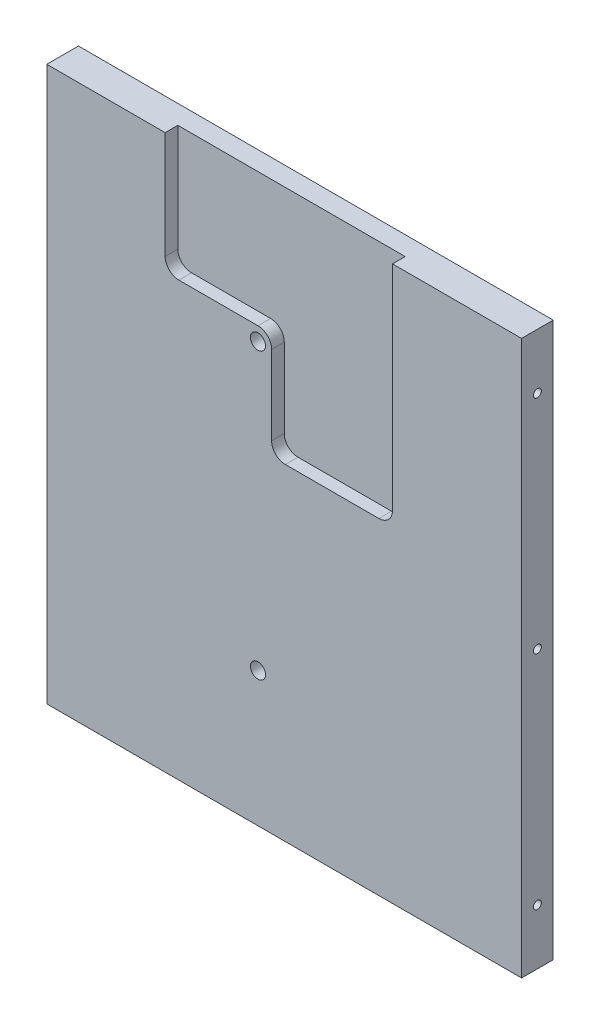
from build123d import *

# Parameters (mm, degrees)
SKIZZE1_W                       = 150
SKIZZE1_H                       = 175
AUFSATZ_LINEAR_AUSTRAGEN1_DEPTH = 10
SKIZZE2_R                       = 2.3876
SCHNITT_LINEAR_AUSTRAGEN1_DEPTH = 10
SCHNITT_LINEAR_AUSTRAGEN2_DEPTH = 4
SKIZZE4_R                       = 1.25
SCHNITT_LINEAR_AUSTRAGEN3_DEPTH = 5
SCHNITT_LINEAR_START            = -5
SKIZZE6_R                       = 1.25
SCHNITT_LINEAR_AUSTRAGEN4_DEPTH = 5


with BuildPart() as part:
    # Skizze1 → Aufsatz-Linear austragen1 (new body)
    with BuildSketch(Plane.XY):
        with Locations((-21.140947697, -18.099765847)):
            Rectangle(SKIZZE1_W, SKIZZE1_H)
    extrude(amount=AUFSATZ_LINEAR_AUSTRAGEN1_DEPTH)

    # Skizze2 → Schnitt-Linear austragen1 (cut)
    with BuildSketch(Plane.XY.offset(10)):
        with Locations((-29.425704113, 26.900234153)):
            Circle(SKIZZE2_R)
        with Locations((-29.425704113, -63.099765847)):
            Circle(SKIZZE2_R)
    extrude(amount=-SCHNITT_LINEAR_AUSTRAGEN1_DEPTH, mode=Mode.SUBTRACT)

    # Skizze3 → Schnitt-Linear austragen2 (cut)
    with BuildSketch(Plane.XY.offset(10)):
        with BuildLine():
            Line((-54.425704113, 31.218234153), (-29.425704113, 31.218234153))
            ThreePointArc((-29.425704113, 31.218234153), (-26.372417032, 29.953521235), (-25.107704113, 26.900234153))
            Line((-25.107704113, 26.900234153), (-25.107704113, 1.900234153))
            ThreePointArc((-25.107704113, 1.900234153), (-23.842991195, -1.153052928), (-20.789704113, -2.417765847))
            Line((-20.789704113, -2.417765847), (8.756295887, -2.417765847))
            ThreePointArc((8.756295887, -2.417765847), (11.809582968, -1.153052928), (13.074295887, 1.900234153))
            Line((13.074295887, 1.900234153), (13.074295887, 69.400234153))
            Line((13.074295887, 69.400234153), (-58.743704113, 69.400234153))
            Line((-58.743704113, 69.400234153), (-58.743704113, 35.536234153))
            ThreePointArc((-58.743704113, 35.536234153), (-57.478991195, 32.482947072), (-54.425704113, 31.218234153))
        make_face()
    extrude(amount=-SCHNITT_LINEAR_AUSTRAGEN2_DEPTH, mode=Mode.SUBTRACT)

    # Skizze4 → Schnitt-Linear austragen3 (cut)
    with BuildSketch(Plane.ZY.offset(96.140947697)):
        with Locations((5, 51.900234153)):
            Circle(SKIZZE4_R)
        with Locations((5, -18.099765847)):
            Circle(SKIZZE4_R)
        with Locations((5, -88.099765847)):
            Circle(SKIZZE4_R)
    extrude(amount=-SCHNITT_LINEAR_AUSTRAGEN3_DEPTH, mode=Mode.SUBTRACT)

    # Skizze6 → Schnitt-Linear austragen4 (cut)
    with BuildSketch(Plane(origin=(53.859052303, 0, 0), x_dir=(0, 0, -1), z_dir=(1, 0, 0)).offset(SCHNITT_LINEAR_START)):
        with Locations((-5, 51.900234153)):
            Circle(SKIZZE6_R)
        with Locations((-5, -18.099765847)):
            Circle(SKIZZE6_R)
        with Locations((-5, -88.099765847)):
            Circle(SKIZZE6_R)
    extrude(amount=SCHNITT_LINEAR_AUSTRAGEN4_DEPTH, mode=Mode.SUBTRACT)


solid = part.part
